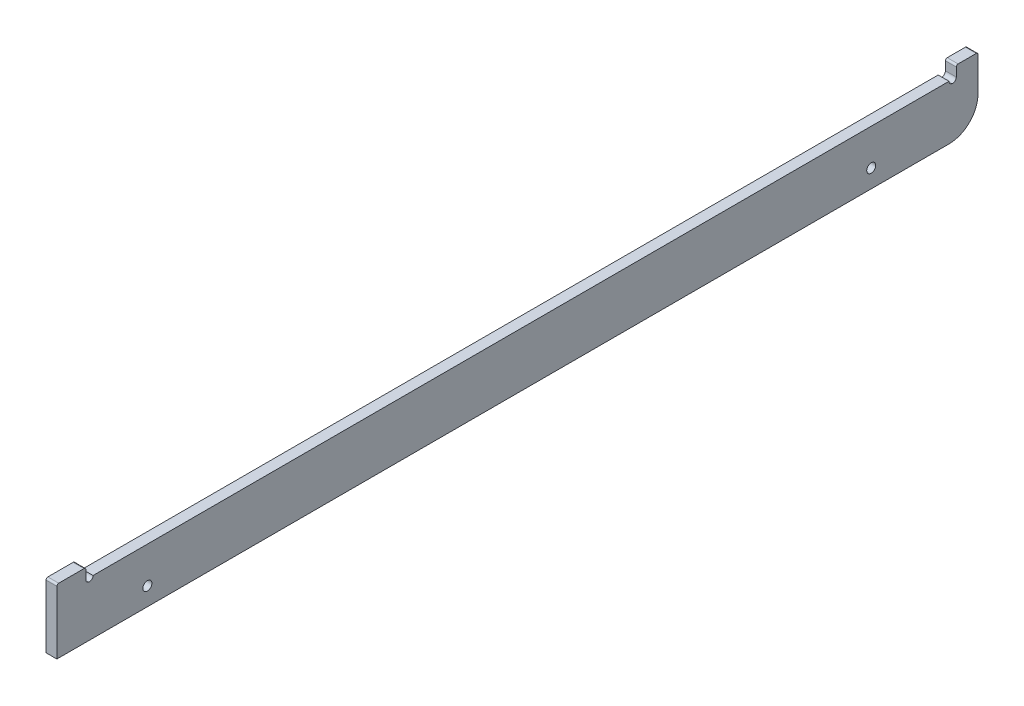
from build123d import *

# Parameters (mm, degrees)
SKETCH_1_W          = 254.5
SKETCH_1_H          = 15
EXTRUDE_1_DEPTH     = 3
SKETCH_2_W          = 8
SKETCH_2_H          = 3
SKETCH_2_W_2        = 6
EXTRUDE_2_DEPTH     = 3
SKETCH_3_R          = 1
CUT_EXTRUDE_1_DEPTH = 3
SKETCH_4_R          = 1.25
CUT_EXTRUDE_2_DEPTH = 10
FILLET_2_R          = 8
SKETCH_5_W          = 255.76516614
SKETCH_5_H          = 0.1
CUT_EXTRUDE_3_DEPTH = 10
FILLET_3_R          = 0.5


with BuildPart() as part:
    # 스케치1 → 보스-돌출1 (new body)
    with BuildSketch(Plane(origin=(0, 0, 0), x_dir=(0, 0, -1), z_dir=(1, 0, 0))):
        with Locations((127.25, 7.5)):
            Rectangle(SKETCH_1_W, SKETCH_1_H)
    extrude(amount=EXTRUDE_1_DEPTH)

    # 스케치2 → 보스-돌출2 (add)
    with BuildSketch(Plane(origin=(3, 0, 0), x_dir=(0, 0, -1), z_dir=(1, 0, 0))):
        with Locations((4, 16.5)):
            Rectangle(SKETCH_2_W, SKETCH_2_H)
        with Locations((251.5, 16.5)):
            Rectangle(SKETCH_2_W_2, SKETCH_2_H)
    extrude(amount=-EXTRUDE_2_DEPTH)

    # 스케치3 → 컷-돌출1 (cut)
    with BuildSketch(Plane(origin=(3, 0, 0), x_dir=(0, 0, -1), z_dir=(1, 0, 0))):
        with Locations((9, 15)):
            Circle(SKETCH_3_R)
        with Locations((247.5, 15)):
            Circle(SKETCH_3_R)
    extrude(amount=-CUT_EXTRUDE_1_DEPTH, mode=Mode.SUBTRACT)

    # 스케치4 → 컷-돌출2 (cut)
    with BuildSketch(Plane(origin=(3, 0, 0), x_dir=(0, 0, -1), z_dir=(1, 0, 0))):
        with Locations((225, 5)):
            Circle(SKETCH_4_R)
        with Locations((25, 5)):
            Circle(SKETCH_4_R)
    extrude(amount=-CUT_EXTRUDE_2_DEPTH, mode=Mode.SUBTRACT)

    # 필렛2
    fillet_2_edges = [part.edges().sort_by_distance(p)[0] for p in [
        (1.5, 0, -254.5),
    ]]
    fillet(fillet_2_edges, radius=FILLET_2_R)

    # 스케치5 → 컷-돌출3 (cut)
    with BuildSketch(Plane(origin=(3, 0, 0), x_dir=(0, 0, -1), z_dir=(1, 0, 0))):
        with Locations((127.88258307, 17.95)):
            Rectangle(SKETCH_5_W, SKETCH_5_H)
    extrude(amount=-CUT_EXTRUDE_3_DEPTH, mode=Mode.SUBTRACT)

    # 필렛3
    fillet_3_edges = [part.edges().sort_by_distance(p)[0] for p in [
        (1.5, 17.9, 0),
        (1.5, 17.9, -8),
        (1.5, 17.9, -248.5),
        (1.5, 17.9, -254.5),
    ]]
    fillet(fillet_3_edges, radius=FILLET_3_R)


solid = part.part
